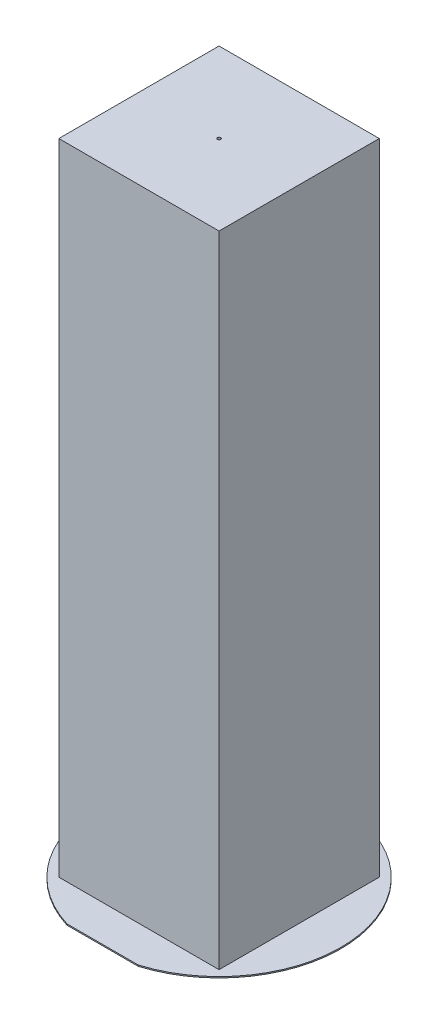
from build123d import *

# Parameters (mm, degrees)
SKETCH1_W           = 50
SKETCH1_H           = 50
SKETCH1_R           = 0.5
BOSS_EXTRUDE1_DEPTH = 0.4
BOSS_EXTRUDE2_DEPTH = 0.381
SKETCH1_2_W         = 50
SKETCH1_2_H         = 50
SKETCH1_2_R         = 0.5
BOSS_EXTRUDE3_DEPTH = 200


with BuildPart() as part:
    # Sketch1 → Boss-Extrude1 (new body)
    with BuildSketch(Plane(origin=(0, 0, 0), x_dir=(1, 0, 0), z_dir=(0, 1, 0))):
        Rectangle(SKETCH1_W, SKETCH1_H)
        Circle(SKETCH1_R, mode=Mode.SUBTRACT)
    extrude(amount=BOSS_EXTRUDE1_DEPTH)

    # Sketch3 → Boss-Extrude2 (add)
    with BuildSketch(Plane(origin=(0, 0, 0), x_dir=(1, 0, 0), z_dir=(0, 1, 0))):
        with BuildLine():
            ThreePointArc((38, 0), (-22.60331834, 30.546521897), (-11.11, -36.339618875))
            Line((-11.11, -36.339618875), (11.11, -36.339618875))
            ThreePointArc((11.11, -36.339618875), (30.546521897, -22.60331834), (38, 0))
        make_face()
    extrude(amount=BOSS_EXTRUDE2_DEPTH)

    # Sketch1<2> → Boss-Extrude3 (add)
    with BuildSketch(Plane(origin=(0, 0, 0), x_dir=(1, 0, 0), z_dir=(0, 1, 0))):
        Rectangle(SKETCH1_2_W, SKETCH1_2_H)
        Circle(SKETCH1_2_R, mode=Mode.SUBTRACT)
    extrude(amount=BOSS_EXTRUDE3_DEPTH)


solid = part.part
